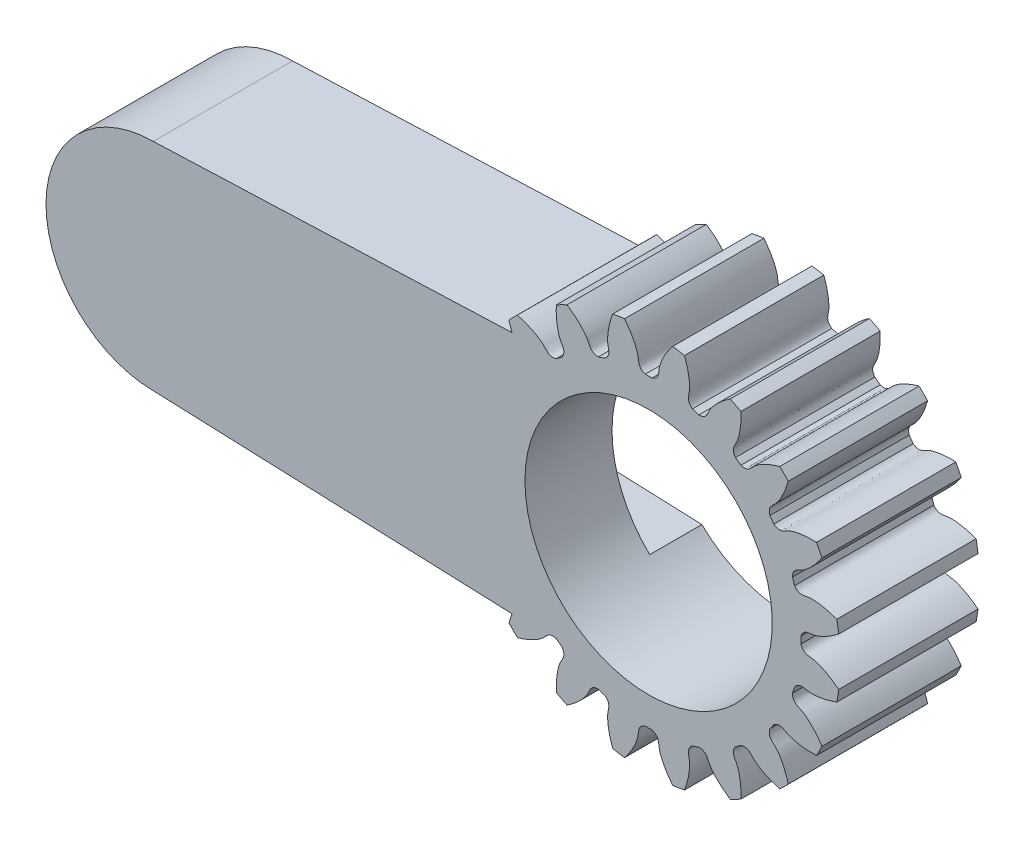
from build123d import *

# Parameters (mm, degrees)
SKETCH_1_R               = 5.5
EXTRUDE_1_DEPTH          = 4
CUT_EXTRUDE_1_DEPTH      = 9.746427842
PATTERN_CIRCULAR_1_COUNT = 20
SKETCH_4_R               = 3.55
CUT_EXTRUDE_2_DEPTH      = 9.692006634
EXTRUDE_4_DEPTH          = 1.5
CUT_EXTRUDE_3_DEPTH      = 1.5
EXTRUDE_START            = -4
EXTRUDE_3_DEPTH          = 2.5


with BuildPart() as part:
    # 草图1 → 凸台-拉伸1 (new body)
    with BuildSketch(Plane.XY):
        Circle(SKETCH_1_R)
    extrude(amount=EXTRUDE_1_DEPTH)

    # 草图2 → 切除-拉伸1 (cut, through all)
    with BuildSketch(Plane.XY):
        with BuildLine():
            ThreePointArc((0.0966583, 4.373932118), (0, 4.375), (-0.0966583, 4.373932118))
            add(Edge.make_bspline(
                [(-0.0966583, 4.373932118), (-0.305594702, 4.446737756), (-0.27854205, 4.593556849), (-0.306448528, 4.735004701), (-0.309446093, 4.748778307), (-0.313155445, 4.764317308), (-0.317646048, 4.781598418), (-0.32298957, 4.800595748), (-0.329256028, 4.821281414), (-0.336514936, 4.843625367), (-0.344834875, 4.867595474), (-0.35428355, 4.893157523), (-0.364927699, 4.92027525), (-0.376833051, 4.948910365), (-0.390064266, 4.979022576), (-0.404684882, 5.010569616), (-0.420757267, 5.043507275), (-0.438342558, 5.077789431), (-0.457500619, 5.113368075), (-0.478289983, 5.150193352), (-0.500767805, 5.18821359), (-0.524989813, 5.227375339), (-0.551010261, 5.267623403), (-0.578881878, 5.308900882), (-0.608655826, 5.35114921), (-0.64038165, 5.394308195), (-0.67410724, 5.43831606), (-0.709878781, 5.483109486), (-0.747740713, 5.528623656), (-0.787735693, 5.574792297), (-0.829904548, 5.621547731), (-0.874286244, 5.668820917), (-0.920917842, 5.716541501), (-0.969834463, 5.764637863), (-1.021069253, 5.81303717), (-1.074653349, 5.861665421), (-1.130615845, 5.910447505), (-1.188983759, 5.95930725), (-1.249782006, 6.008167473), (-1.313033367, 6.056950041), (-1.37875845, 6.10557592), (-1.470736795, 6.170819934), (-1.541966206, 6.218166301), (-1.590578991, 6.24912593)],
                knots=[0, 0, 0, 0, 0.165916003, 0.170905922, 0.176663519, 0.183188797, 0.190481754, 0.198542391, 0.207370708, 0.216966704, 0.22733038, 0.238461736, 0.250360771, 0.263027487, 0.276461881, 0.290663956, 0.30563371, 0.321371144, 0.337876258, 0.355149051, 0.373189524, 0.391997677, 0.411573509, 0.431917021, 0.453028213, 0.474907084, 0.497553636, 0.520967867, 0.545149777, 0.570099367, 0.595816637, 0.622301587, 0.649554216, 0.677574526, 0.706362514, 0.735918183, 0.766241531, 0.797332559, 0.829191267, 0.861817654, 0.895211721, 0.929373468, 1, 1, 1, 1], degree=3))
            ThreePointArc((-1.590578991, 6.24912593), (0, 6.44837316), (1.590578991, 6.24912593))
            add(Edge.make_bspline(
                [(0.0966583, 4.373932118), (0.305594702, 4.446737756), (0.27854205, 4.593556849), (0.306448528, 4.735004701), (0.309446093, 4.748778307), (0.313155445, 4.764317308), (0.317646048, 4.781598418), (0.32298957, 4.800595748), (0.329256028, 4.821281414), (0.336514936, 4.843625367), (0.344834875, 4.867595474), (0.35428355, 4.893157523), (0.364927699, 4.92027525), (0.376833051, 4.948910365), (0.390064266, 4.979022576), (0.404684882, 5.010569616), (0.420757267, 5.043507275), (0.438342558, 5.077789431), (0.457500619, 5.113368075), (0.478289983, 5.150193352), (0.500767805, 5.18821359), (0.524989813, 5.227375339), (0.551010261, 5.267623403), (0.578881878, 5.308900882), (0.608655826, 5.35114921), (0.64038165, 5.394308195), (0.67410724, 5.43831606), (0.709878781, 5.483109486), (0.747740713, 5.528623656), (0.787735693, 5.574792297), (0.829904548, 5.621547731), (0.874286244, 5.668820917), (0.920917842, 5.716541501), (0.969834463, 5.764637863), (1.021069253, 5.81303717), (1.074653349, 5.861665421), (1.130615845, 5.910447505), (1.188983759, 5.95930725), (1.249782006, 6.008167473), (1.313033367, 6.056950041), (1.37875845, 6.10557592), (1.470736795, 6.170819934), (1.541966206, 6.218166301), (1.590578991, 6.24912593)],
                knots=[0, 0, 0, 0, 0.165916003, 0.170905922, 0.176663519, 0.183188797, 0.190481754, 0.198542391, 0.207370708, 0.216966704, 0.22733038, 0.238461736, 0.250360771, 0.263027487, 0.276461881, 0.290663956, 0.30563371, 0.321371144, 0.337876258, 0.355149051, 0.373189524, 0.391997677, 0.411573509, 0.431917021, 0.453028213, 0.474907084, 0.497553636, 0.520967867, 0.545149777, 0.570099367, 0.595816637, 0.622301587, 0.649554216, 0.677574526, 0.706362514, 0.735918183, 0.766241531, 0.797332559, 0.829191267, 0.861817654, 0.895211721, 0.929373468, 1, 1, 1, 1], degree=3))
        make_face()
    cut_extrude_1 = extrude(amount=CUT_EXTRUDE_1_DEPTH, mode=Mode.SUBTRACT)

    # 阵列(圆周)1: 切除-拉伸1 ×20 about axis
    pattern_circular_1_axis = Axis((0, 0, 4), (0, 0, -1))
    for i in range(1, PATTERN_CIRCULAR_1_COUNT):
        add(cut_extrude_1.rotate(pattern_circular_1_axis, i * 360 / PATTERN_CIRCULAR_1_COUNT), mode=Mode.SUBTRACT)

    # 草图4 → 切除-拉伸2 (cut, through all)
    with BuildSketch(Plane(origin=(0, 0, 0), x_dir=(-1, 0, 0), z_dir=(0, 0, -1))):
        Circle(SKETCH_4_R)
    extrude(amount=-CUT_EXTRUDE_2_DEPTH, mode=Mode.SUBTRACT)

    # 草图5 → 拉伸-薄壁4 (add)
    with BuildSketch(Plane(origin=(0, 0, 0), x_dir=(-1, 0, 0), z_dir=(0, 0, -1))):
        with BuildLine():
            Line((14.221034476, 3.099928636), (1.469817807, 3.589098149))
            Line((1.469817807, 3.589098149), (1.469817807, -3.589098149))
            Line((1.469817807, -3.589098149), (14.221034476, -3.099928636))
            ThreePointArc((14.221034476, -3.099928636), (17.3, 0), (14.221034476, 3.099928636))
        make_face()
        with BuildLine():
            Line((14.2, 2.1), (2.469817807, 2.55))
            Line((2.469817807, 2.55), (2.469817807, -2.55))
            Line((2.469817807, -2.55), (14.2, -2.1))
            ThreePointArc((14.2, -2.1), (16.3, 0), (14.2, 2.1))
        make_face(mode=Mode.SUBTRACT)
    extrude(amount=-EXTRUDE_4_DEPTH)

    # 草图6 → 切除-拉伸3 (cut)
    with BuildSketch(Plane(origin=(0, 0, 0), x_dir=(-1, 0, 0), z_dir=(0, 0, -1))):
        with BuildLine():
            Line((2.469817807, 2.55), (5.935938526, 2.417030682))
            Line((5.935938526, 2.417030682), (5.935938526, -2.417030682))
            Line((5.935938526, -2.417030682), (2.469817807, -2.55))
            ThreePointArc((2.469817807, -2.55), (1.999066953, -2.933637898), (1.469817807, -3.231429345))
            Line((1.469817807, -3.231429345), (1.469817807, 3.231429345))
            ThreePointArc((1.469817807, 3.231429345), (1.999066953, 2.933637898), (2.469817807, 2.55))
        make_face()
    extrude(amount=-CUT_EXTRUDE_3_DEPTH, mode=Mode.SUBTRACT)

    # 草图7 → 凸台-拉伸3 (add)
    with BuildSketch(Plane(origin=(0, 0, 0), x_dir=(-1, 0, 0), z_dir=(0, 0, -1)).offset(EXTRUDE_START)):
        with BuildLine():
            Line((3.919419576, -3.495125116), (14.221034476, -3.099928636))
            ThreePointArc((14.221034476, -3.099928636), (17.3, 0), (14.221034476, 3.099928636))
            Line((14.221034476, 3.099928636), (3.919419575, 3.495125116))
            Line((3.919419575, 3.495125116), (2.469817807, 2.55))
            ThreePointArc((2.469817807, 2.55), (3.55, 0), (2.469817807, -2.55))
            Line((2.469817807, -2.55), (3.919419576, -3.495125116))
        make_face()
    extrude(amount=EXTRUDE_3_DEPTH)


solid = part.part
